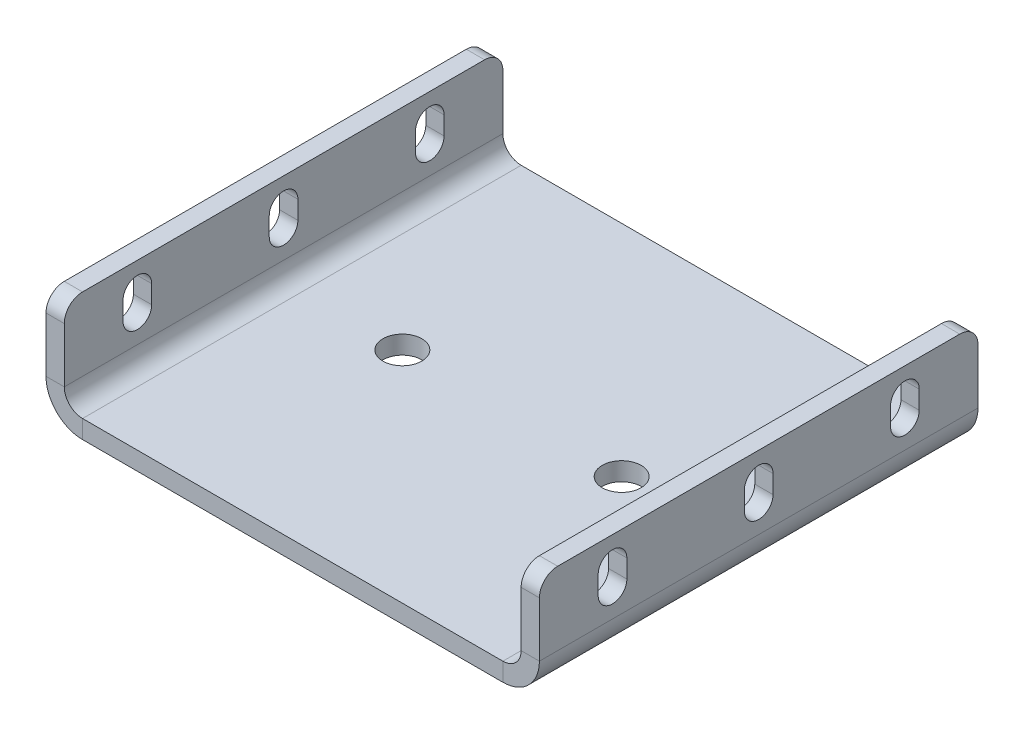
from build123d import *

# Parameters (mm, degrees)
BASE_FLANGE1_DEPTH = 76.2
CUT_EXTRUDE1_DEPTH = 117.26744224
SKETCH7_R          = 3.3782
CUT_EXTRUDE2_DEPTH = 117.26744224
FILLET1_R          = 3.175


# Sheet-metal steps are written as plain solids
with BuildPart() as part:
    # Sketch1 → Base-Flange1 (new body)
    with BuildSketch(Plane.XY):
        with BuildLine():
            Line((85.725, 19.05), (85.725, 6.35))
            ThreePointArc((85.725, 6.35), (83.865128061, 1.859871939), (79.375, 0))
            Line((79.375, 0), (6.35, 0))
            ThreePointArc((6.35, 0), (1.859871939, 1.859871939), (0, 6.35))
            Line((0, 6.35), (0, 19.05))
            Line((0, 19.05), (3.175, 19.05))
            Line((3.175, 19.05), (3.175, 6.35))
            ThreePointArc((3.175, 6.35), (4.10493597, 4.10493597), (6.35, 3.175))
            Line((6.35, 3.175), (79.375, 3.175))
            ThreePointArc((79.375, 3.175), (81.62006403, 4.10493597), (82.55, 6.35))
            Line((82.55, 6.35), (82.55, 19.05))
            Line((82.55, 19.05), (85.725, 19.05))
        make_face()
    extrude(amount=BASE_FLANGE1_DEPTH)

    # Sketch6 → Cut-Extrude1 (cut, through all)
    with BuildSketch(Plane.ZY):
        with BuildLine():
            Line((35.6108, 11.1125), (35.6108, 14.2875))
            ThreePointArc((35.6108, 14.2875), (38.1, 16.7767), (40.5892, 14.2875))
            Line((40.5892, 14.2875), (40.5892, 11.1125))
            ThreePointArc((40.5892, 11.1125), (38.1, 8.6233), (35.6108, 11.1125))
        make_face()
        with BuildLine():
            Line((10.2108, 11.1125), (10.2108, 14.2875))
            ThreePointArc((10.2108, 14.2875), (12.7, 16.7767), (15.1892, 14.2875))
            Line((15.1892, 14.2875), (15.1892, 11.1125))
            ThreePointArc((15.1892, 11.1125), (12.7, 8.6233), (10.2108, 11.1125))
        make_face()
        with BuildLine():
            Line((61.0108, 11.1125), (61.0108, 14.2875))
            ThreePointArc((61.0108, 14.2875), (63.5, 16.7767), (65.9892, 14.2875))
            Line((65.9892, 14.2875), (65.9892, 11.1125))
            ThreePointArc((65.9892, 11.1125), (63.5, 8.6233), (61.0108, 11.1125))
        make_face()
    extrude(amount=-CUT_EXTRUDE1_DEPTH, mode=Mode.SUBTRACT)

    # Sketch7 → Cut-Extrude2 (cut, through all)
    with BuildSketch(Plane.XZ):
        with Locations(Location((61.9125, 38.1, 0), (0, 0, 270))):
            Circle(SKETCH7_R)
        with Locations(Location((23.8125, 38.1, 0), (0, 0, 270))):
            Circle(SKETCH7_R)
    extrude(amount=-CUT_EXTRUDE2_DEPTH, mode=Mode.SUBTRACT)

    # Fillet1
    fillet1_edges = [part.edges().sort_by_distance(p)[0] for p in [
        (1.5875, 19.05, 0),
        (84.1375, 19.05, 0),
        (1.5875, 19.05, 76.2),
        (84.1375, 19.05, 76.2),
    ]]
    fillet(fillet1_edges, radius=FILLET1_R)


solid = part.part
